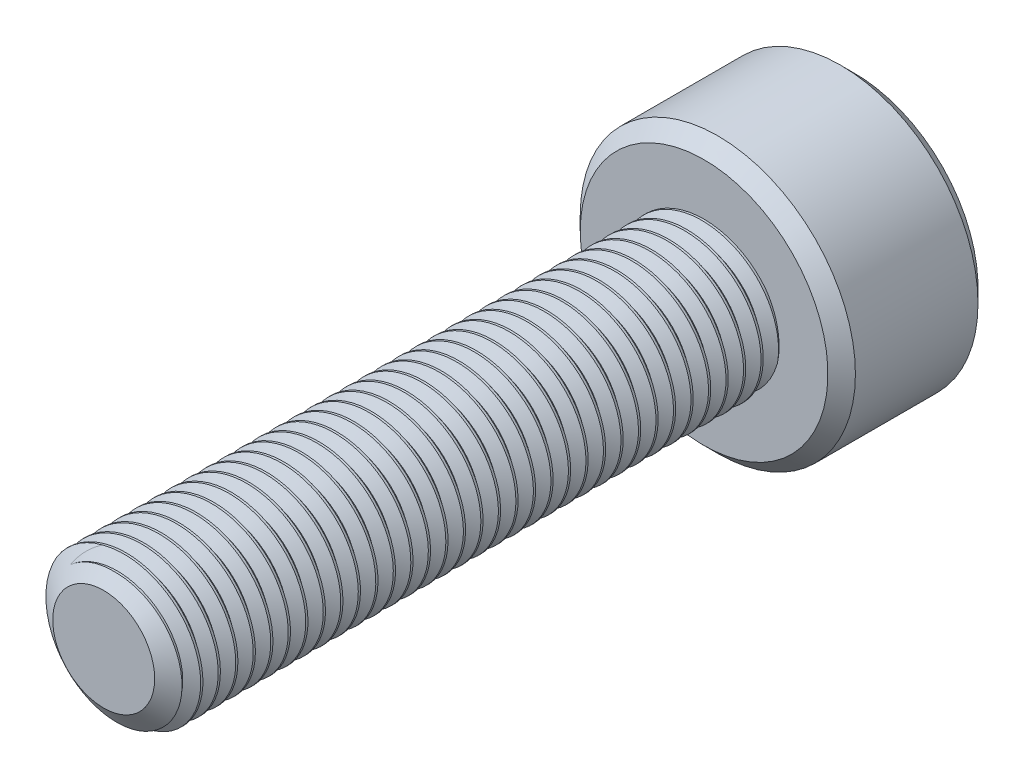
from build123d import *

# Parameters (mm, degrees)
SKETCH1_R          = 1.5
EXTRUDE1_DEPTH     = 12
CUT_SWEEP1_PITCH   = 0.35
SKETCH6_R          = 2.75
EXTRUDE2_DEPTH     = 3
CUT_EXTRUDE1_DEPTH = 1.875
CHAMFER1_SIZE      = 0.275


with BuildPart() as part:
    # Sketch1 → Extrude1 (new body)
    with BuildSketch(Plane.XY):
        Circle(SKETCH1_R)
    extrude(amount=-EXTRUDE1_DEPTH)

    # Cut-Sweep1: arcs per turn and ends read off the stored shape
    # Cut-Sweep1: the profile of Sketch3 profile screwed along a right-hand helix through 37 turns, 6 arcs to a turn; built about Z, then put on its axis
    cut_sweep1_z = Axis((0, 0, 0), (0, 0, 1))
    cut_sweep1_corners = [(1.5003, 0, -0.656423205), (1.272668332, 0, -0.525), (1.272668332, 0, -0.48125), (1.5003, 0, -0.349826795)]
    with BuildLine(mode=Mode.PRIVATE) as cut_sweep1_profile:
        Line(cut_sweep1_corners[0], cut_sweep1_corners[1])
        Line(cut_sweep1_corners[1], cut_sweep1_corners[2])
        Line(cut_sweep1_corners[2], cut_sweep1_corners[3])
        Line(cut_sweep1_corners[3], cut_sweep1_corners[0])
    cut_sweep1_cap = Face(cut_sweep1_profile.wire())
    cut_sweep1_turn_angles = [0, 30, 60, 90, 120, 150, 180, 210, 240, 270, 300, 330, 360]
    cut_sweep1_turn_weights = [1, 0.8660254037844387, 1, 0.8660254037844387, 1, 0.8660254037844387, 1, 0.8660254037844387, 1, 0.8660254037844387, 1, 0.8660254037844387, 1]
    cut_sweep1_turn_rails = [Edge.make_bspline([Vector(p[0], p[1], 0).rotate(cut_sweep1_z, cut_sweep1_turn_angles[k]) / cut_sweep1_turn_weights[k] + Vector(0, 0, p[2] + CUT_SWEEP1_PITCH * cut_sweep1_turn_angles[k] / 360) for k in range(13)], [0, 0, 0, 1, 1, 2, 2, 3, 3, 4, 4, 5, 5, 6, 6, 6], 2, cut_sweep1_turn_weights) for p in cut_sweep1_corners]
    cut_sweep1_turn_sides = [Face.make_surface_from_curves(cut_sweep1_turn_rails[p[0]], cut_sweep1_turn_rails[p[1]]) for p in [(0, 1), (1, 2), (2, 3), (3, 0)]]
    cut_sweep1 = Plane(origin=(0, 0, 0), x_dir=(0, 1, 0), z_dir=(0, 0, -1)) * Solid(Shell([*[p.moved(Location((0, 0, CUT_SWEEP1_PITCH * i))) for i in range(37) for p in cut_sweep1_turn_sides], cut_sweep1_cap, cut_sweep1_cap.rotate(cut_sweep1_z, 13320).moved(Location((0, 0, CUT_SWEEP1_PITCH * 13320 / 360)))]))
    add(cut_sweep1, mode=Mode.SUBTRACT)

    # Sketch4 → Cut-Revolve1 (revolve, cut)
    with BuildSketch(Plane(origin=(0, 0, 0), x_dir=(0, 0, -1), z_dir=(1, 0, 0)), mode=Mode.PRIVATE) as cut_revolve1_sk:
        Polygon((0.337032063, 1.5), (0, 1.018668332), (0, 1.5), align=None)
    revolve(cut_revolve1_sk.sketch.rotate(Axis((0, 0, 0), (0, 0, -1)), 301.815814274), axis=Axis((0, 0, 0), (0, 0, -1)), mode=Mode.SUBTRACT)

    # Sketch6 → Extrude2 (add)
    with BuildSketch(Plane(origin=(0, 0, -12), x_dir=(-1, 0, 0), z_dir=(0, 0, -1))):
        Circle(SKETCH6_R)
    extrude(amount=EXTRUDE2_DEPTH)

    # Sketch7 → Cut-Extrude1 (cut)
    with BuildSketch(Plane(origin=(0, 0, -15), x_dir=(-1, 0, 0), z_dir=(0, 0, -1))):
        Polygon((0, 1.443375673), (-1.25, 0.721687836), (-1.25, -0.721687836), (0, -1.443375673), (1.25, -0.721687836), (1.25, 0.721687836), align=None)
    extrude(amount=-CUT_EXTRUDE1_DEPTH, mode=Mode.SUBTRACT)

    # Cut-Extrude2 cone 1 section (through the dimple's axis) → Cut-Extrude2 (revolve, cut)
    with BuildSketch(Plane(origin=(0, 0, -15), x_dir=(0, 1, 0), z_dir=(1, 0, 0))):
        Polygon((0, 0), (1.443375673, 0), (0, 1.443375673), align=None)
    revolve(axis=Axis((0, 0, -15), (0, 0, 1)), mode=Mode.SUBTRACT)

    # Chamfer1
    chamfer1_edges = [part.edges().sort_by_distance(p)[0] for p in [
        (2.75, 0, -12),
        (2.75, 0, -15),
    ]]
    chamfer(chamfer1_edges, length=CHAMFER1_SIZE)


solid = part.part
